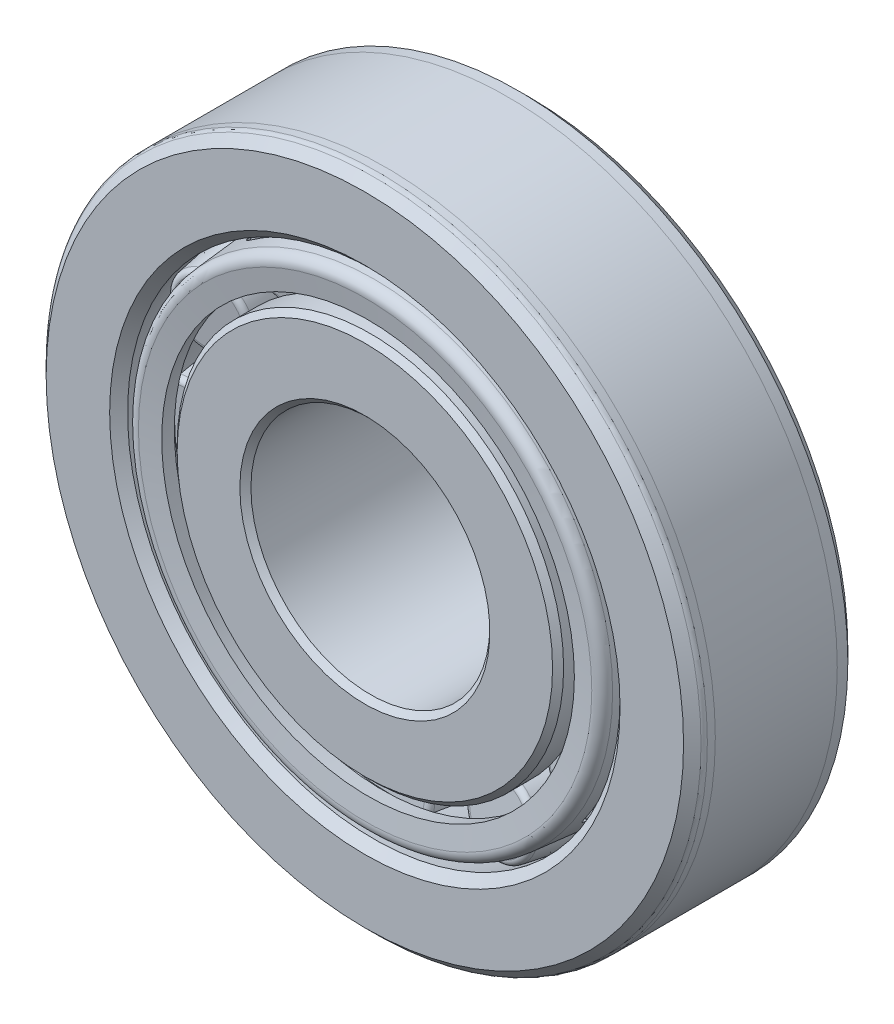
from build123d import *
from OCP.BRepFilletAPI import BRepFilletAPI_MakeChamfer

# Parameters (mm, degrees)
SKETCH8_R                 = 1.08416
CUT_EXTRUDE1_DEPTH        = 0.635
FILLET7_R                 = 0.9525
CHAMFER4_SIZE             = 0.27104
CHAMFER4_SIZE2            = 0.261780509
FILLET8_R                 = 0.2904
CIRPATTERN1_COUNT         = 12
FILLET9_R                 = 0.546100006
FILLET10_R                = 0.25675
FILLET11_R                = 0.1936
CIRPATTERN2_COUNT         = 12
FILLET11_OF_CIRPATTERN2_R = 0.1936
CHAMFER1_SIZE             = 0.5625
CHAMFER1_SIZE2            = 0.484041872
FILLET6_R                 = 0.3375
CHAMFER2_SIZE             = 0.293962498
CHAMFER3_SIZE             = 0.445999997
CHAMFER5_SIZE             = 0.5625
CHAMFER6_SIZE             = 0.16875
CHAMFER6_SIZE2            = 0.209381446


with BuildPart() as part:
    # Sketch2 → Revolve1 (revolve)
    with BuildSketch(Plane(origin=(0, 0, 0), x_dir=(0, 0, -1), z_dir=(1, 0, 0)), mode=Mode.PRIVATE) as revolve1_sk:
        Polygon((-4.3655, 17.5), (-4.3655, 13), (4.3655, 14.58), (4.3655, 17.5), align=None)
    revolve(revolve1_sk.sketch.rotate(Axis((0, 0, 0), (0, 0, -1)), 90), axis=Axis((0, 0, 0), (0, 0, -1)))

    # Chamfer1: one chamfer whose edges measure the first distance from different faces: ONE call of the kernel's chamfer builder (chamfer() names one face for all edges)
    chamfer1_edges_1 = [part.edges().sort_by_distance(p)[0] for p in [
        (-13, 0, 4.3655),
    ]]
    chamfer1_side_1 = [part.faces().sort_by_distance(p)[0] for p in [
        (-17.005025253, 0, 4.3655),
    ]]
    chamfer1_edges_2 = [part.edges().sort_by_distance(p)[0] for p in [
        (-17.5, 0, 4.3655),
    ]]
    chamfer1 = BRepFilletAPI_MakeChamfer(part.part.solid().wrapped)
    for e in chamfer1_edges_1:
        chamfer1.Add(CHAMFER1_SIZE, CHAMFER1_SIZE2, e.wrapped, chamfer1_side_1[0].wrapped)  # the first distance lies on this face
    for e in chamfer1_edges_2:
        chamfer1.Add(CHAMFER1_SIZE, e.wrapped)
    add(Compound.cast(chamfer1.Shape()), mode=Mode.REPLACE)

    # Fillet6
    fillet6_edges = [part.edges().sort_by_distance(p)[0] for p in [
        (-17.5, 0, 3.803),
    ]]
    fillet(fillet6_edges, radius=FILLET6_R)

    # Chamfer5
    chamfer5_edges = [part.edges().sort_by_distance(p)[0] for p in [
        (-17.5, 0, -4.3655),
    ]]
    chamfer(chamfer5_edges, length=CHAMFER5_SIZE)

    # Chamfer6
    chamfer6_edges = [part.edges().sort_by_distance(p)[0] for p in [
        (-14.58, 0, -4.3655),
    ]]
    chamfer6_side = [part.faces().sort_by_distance(p)[0] for p in [
        (-13.833097178, 0, -0.238152822),
    ]]
    chamfer(chamfer6_edges, length=CHAMFER6_SIZE, length2=CHAMFER6_SIZE2, reference=chamfer6_side[0])


with BuildPart() as body_2:
    # Sketch3 → Revolve2 (revolve)
    with BuildSketch(Plane(origin=(0, 0, 0), x_dir=(0, 0, -1), z_dir=(1, 0, 0)), mode=Mode.PRIVATE) as revolve2_sk:
        Polygon((-4.365, 10.269499972), (-4.365, 6.35), (6.7475, 6.35), (6.7475, 10.80999997), (3.685069361, 10.80999997), (3.791344865, 10.071881925), (-2.621514302, 9.383263177), (-2.749116197, 10.269499972), align=None)
    revolve(revolve2_sk.sketch.rotate(Axis((0, 0, 0), (0, 0, -1)), 90), axis=Axis((0, 0, 0), (0, 0, -1)))

    # Chamfer2
    chamfer2_edges = [body_2.edges().sort_by_distance(p)[0] for p in [
        (-6.35, 0, 4.365),
        (-10.269499972, 0, 4.365),
    ]]
    chamfer(chamfer2_edges, length=CHAMFER2_SIZE)

    # Chamfer3
    chamfer3_edges = [body_2.edges().sort_by_distance(p)[0] for p in [
        (-10.80999997, 0, -6.7475),
        (-6.35, 0, -6.7475),
    ]]
    chamfer(chamfer3_edges, length=CHAMFER3_SIZE)


with BuildPart() as body_3:
    # Sketch4 → Revolve3 (revolve)
    with BuildSketch(Plane(origin=(0, 0, 0), x_dir=(0, 0, -1), z_dir=(1, 0, 0)), mode=Mode.PRIVATE) as revolve3_sk:
        Polygon((6.4935, 12.904201063), (6.380915437, 13.68613758), (-4.433522679, 12.611289923), (-4.196623156, 10.965945451), (-3.414686639, 11.078530014), (-3.47097892, 11.469498273), align=None)
    revolve(revolve3_sk.sketch.rotate(Axis((0, 0, 0), (0, 0, -1)), 90), axis=Axis((0, 0, 0), (0, 0, -1)))

    # Fillet9
    fillet9_edges = [body_3.edges().sort_by_distance(p)[0] for p in [
        (-12.611289923, 0, 4.433522679),
    ]]
    fillet(fillet9_edges, radius=FILLET9_R)

    # Fillet10
    fillet10_edges = [body_3.edges().sort_by_distance(p)[0] for p in [
        (-13.68613758, 0, -6.380915437),
        (-12.904201063, 0, -6.4935),
    ]]
    fillet(fillet10_edges, radius=FILLET10_R)

    # Sketch9 → Cut-Revolve2 (revolve, cut)
    with BuildSketch(Plane(origin=(0, 0, 0), x_dir=(0, 0, -1), z_dir=(1, 0, 0)), mode=Mode.PRIVATE) as cut_revolve2_sk:
        Polygon((-2.897417736, 11.29950254), (3.482333018, 12.218070012), (3.81205106, 9.928070649), (-2.600808107, 9.239451901), align=None)
    cut_revolve2 = revolve(cut_revolve2_sk.sketch.rotate(Axis((0, 11.29950254, 2.897417736), (0, 0.14251210477072696, -0.9897930591764207)), 180), axis=Axis((0, 11.29950254, 2.897417736), (0, 0.14251210477072696, -0.9897930591764207)), mode=Mode.SUBTRACT)

    # Fillet11
    fillet11_edges = [body_3.edges().sort_by_distance(p)[0] for p in [
        (-1.939183299, 12.047666968, 3.005139736),
        (1.939183299, 12.047666968, 3.005139736),
        (2.250338019, 12.749976614, -3.405748192),
        (-2.250338019, 12.749976614, -3.405748192),
    ]]
    fillet(fillet11_edges, radius=FILLET11_R)

    # CirPattern2: Cut-Revolve2 ×12 about axis
    cirpattern2_axis = Axis((0, 0, 0), (0, 0, 1))
    for i in range(1, CIRPATTERN2_COUNT):
        add(cut_revolve2.rotate(cirpattern2_axis, i * 360 / CIRPATTERN2_COUNT), mode=Mode.SUBTRACT)

    # Fillet11 of CirPattern2
    fillet11_of_cirpattern2_edges = [body_3.edges().sort_by_distance(p)[0] for p in [
        (-7.703215483, 9.463994001, 3.005139736),
        (-4.344451484, 11.4031773, 3.005139736),
        (-4.426138416, 12.166972655, -3.405748192),
        (-8.323838198, 9.916634636, -3.405748192),
        (-11.4031773, 4.344451484, 3.005139736),
        (-9.463994001, 7.703215483, 3.005139736),
        (-9.916634636, 8.323838198, -3.405748192),
        (-12.166972655, 4.426138416, -3.405748192),
        (-12.047666968, -1.939183299, 3.005139736),
        (-12.047666968, 1.939183299, 3.005139736),
        (-12.749976614, 2.250338019, -3.405748192),
        (-12.749976614, -2.250338019, -3.405748192),
        (-9.463994001, -7.703215483, 3.005139736),
        (-11.4031773, -4.344451484, 3.005139736),
        (-12.166972655, -4.426138416, -3.405748192),
        (-9.916634636, -8.323838198, -3.405748192),
        (-4.344451484, -11.4031773, 3.005139736),
        (-7.703215483, -9.463994001, 3.005139736),
        (-8.323838198, -9.916634636, -3.405748192),
        (-4.426138416, -12.166972655, -3.405748192),
        (1.939183299, -12.047666968, 3.005139736),
        (-1.939183299, -12.047666968, 3.005139736),
        (-2.250338019, -12.749976614, -3.405748192),
        (2.250338019, -12.749976614, -3.405748192),
        (7.703215483, -9.463994001, 3.005139736),
        (4.344451484, -11.4031773, 3.005139736),
        (4.426138416, -12.166972655, -3.405748192),
        (8.323838198, -9.916634636, -3.405748192),
        (11.4031773, -4.344451484, 3.005139736),
        (9.463994001, -7.703215483, 3.005139736),
        (9.916634636, -8.323838198, -3.405748192),
        (12.166972655, -4.426138416, -3.405748192),
        (12.047666968, 1.939183299, 3.005139736),
        (12.047666968, -1.939183299, 3.005139736),
        (12.749976614, -2.250338019, -3.405748192),
        (12.749976614, 2.250338019, -3.405748192),
        (9.463994001, 7.703215483, 3.005139736),
        (11.4031773, 4.344451484, 3.005139736),
        (12.166972655, 4.426138416, -3.405748192),
        (9.916634636, 8.323838198, -3.405748192),
        (4.344451484, 11.4031773, 3.005139736),
        (7.703215483, 9.463994001, 3.005139736),
        (8.323838198, 9.916634636, -3.405748192),
        (4.426138416, 12.166972655, -3.405748192),
    ]]
    fillet(fillet11_of_cirpattern2_edges, radius=FILLET11_OF_CIRPATTERN2_R)


with BuildPart() as body_4:
    # Sketch6 → Revolve4 (revolve)
    with BuildSketch(Plane(origin=(0, 0, 0), x_dir=(0, 0, -1), z_dir=(1, 0, 0))):
        Polygon((3.791344865, 10.071881925), (3.482333018, 12.218070012), (-2.897417736, 11.29950254), (-2.621514302, 9.383263177), align=None)
    revolve(axis=Axis((0, 11.29950254, 2.897417736), (0, 0.14251210477072693, -0.9897930591764207)))

    # Sketch8 → Cut-Extrude1 (cut)
    with BuildSketch(Plane(origin=(0, 0.739354499, -5.135058194), x_dir=(-1, 0, 0), z_dir=(0, 0.14251210477072696, -0.9897930591764208))):
        with Locations(Location((0, 11.597086286, 0), (0, 0, 90))):
            Circle(SKETCH8_R)
    extrude(amount=-CUT_EXTRUDE1_DEPTH, mode=Mode.SUBTRACT)

    # Fillet7
    # the kernel refuses this fillet: 0.9525 mm, written as the material it adds along each edge
    with BuildSketch(Plane(origin=(0, 12.127574825, -2.853814426), x_dir=(0, 0.9897930591764206, 0.14251210477072698), z_dir=(-1, 0, 0))) as fillet7_piece_1:
        with BuildLine():
            CenterArc((0.186134388, 0.9525), FILLET7_R, 270, 70.528779366)
            Line((0.186134388, 0), (0.186134388, -0.01905))
            Line((0.186134388, -0.01905), (1.08416, -0.01905))
            Line((1.08416, -0.01905), (1.10321, 0))
            ThreePointArc((1.10321, 0), (1.10321, 0.3175), (1.102120512, 0.62865))
            Line((1.102120512, 0.62865), (1.08416, 0.635))
        make_face()
    revolve(axis=Axis((0, 12.127574825, -2.853814426), (0, 0.14251210477072696, -0.9897930591764208)))

    # Chamfer4
    chamfer4_edges = [body_4.edges().sort_by_distance(p)[0] for p in [
        (0, 14.364258098, -3.173321171),
    ]]
    chamfer4_side = [body_4.faces().sort_by_distance(p)[0] for p in [
        (0, 14.303554732, -3.182061346),
    ]]
    chamfer(chamfer4_edges, length=CHAMFER4_SIZE, length2=CHAMFER4_SIZE2, reference=chamfer4_side[0])

    # Fillet8
    fillet8_edges = [body_4.edges().sort_by_distance(p)[0] for p in [
        (0, 13.215741902, 3.173321171),
    ]]
    fillet(fillet8_edges, radius=FILLET8_R)


with BuildPart() as cirpattern1_1:
    # CirPattern1: pattern copy
    add(body_4.part.rotate(Axis((0, 0, 0), (0, 0, 1)), 1 * 360 / CIRPATTERN1_COUNT))


with BuildPart() as cirpattern1_2:
    # CirPattern1: pattern copy
    add(body_4.part.rotate(Axis((0, 0, 0), (0, 0, 1)), 2 * 360 / CIRPATTERN1_COUNT))


with BuildPart() as cirpattern1_3:
    # CirPattern1: pattern copy
    add(body_4.part.rotate(Axis((0, 0, 0), (0, 0, 1)), 3 * 360 / CIRPATTERN1_COUNT))


with BuildPart() as cirpattern1_4:
    # CirPattern1: pattern copy
    add(body_4.part.rotate(Axis((0, 0, 0), (0, 0, 1)), 4 * 360 / CIRPATTERN1_COUNT))


with BuildPart() as cirpattern1_5:
    # CirPattern1: pattern copy
    add(body_4.part.rotate(Axis((0, 0, 0), (0, 0, 1)), 5 * 360 / CIRPATTERN1_COUNT))


with BuildPart() as cirpattern1_6:
    # CirPattern1: pattern copy
    add(body_4.part.rotate(Axis((0, 0, 0), (0, 0, 1)), 6 * 360 / CIRPATTERN1_COUNT))


with BuildPart() as cirpattern1_7:
    # CirPattern1: pattern copy
    add(body_4.part.rotate(Axis((0, 0, 0), (0, 0, 1)), 7 * 360 / CIRPATTERN1_COUNT))


with BuildPart() as cirpattern1_8:
    # CirPattern1: pattern copy
    add(body_4.part.rotate(Axis((0, 0, 0), (0, 0, 1)), 8 * 360 / CIRPATTERN1_COUNT))


with BuildPart() as cirpattern1_9:
    # CirPattern1: pattern copy
    add(body_4.part.rotate(Axis((0, 0, 0), (0, 0, 1)), 9 * 360 / CIRPATTERN1_COUNT))


with BuildPart() as cirpattern1_10:
    # CirPattern1: pattern copy
    add(body_4.part.rotate(Axis((0, 0, 0), (0, 0, 1)), 10 * 360 / CIRPATTERN1_COUNT))


with BuildPart() as cirpattern1_11:
    # CirPattern1: pattern copy
    add(body_4.part.rotate(Axis((0, 0, 0), (0, 0, 1)), 11 * 360 / CIRPATTERN1_COUNT))


solid = Compound([part.part, body_2.part, body_3.part, body_4.part, cirpattern1_1.part, cirpattern1_2.part, cirpattern1_3.part, cirpattern1_4.part, cirpattern1_5.part, cirpattern1_6.part, cirpattern1_7.part, cirpattern1_8.part, cirpattern1_9.part, cirpattern1_10.part, cirpattern1_11.part])
